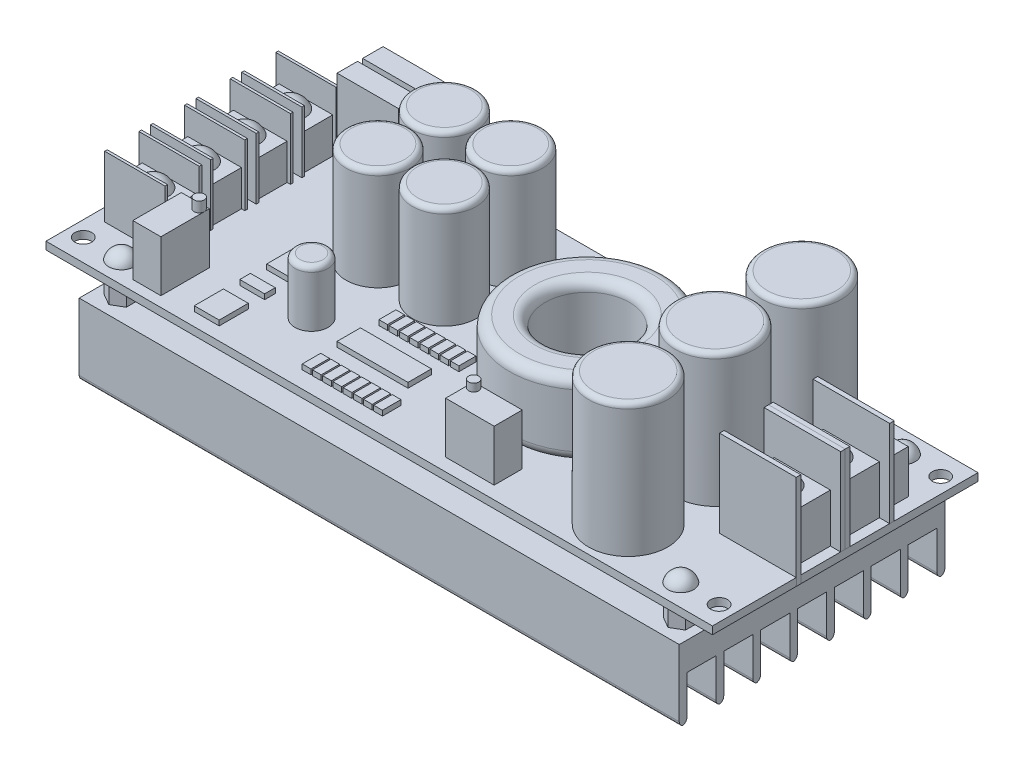
from build123d import *

# Parameters (mm, degrees)
CROQUIS1_W                  = 130.5
CROQUIS1_H                  = 52
CROQUIS1_R                  = 1.65
SALIENTE_EXTRUIR1_DEPTH     = 1.5
SALIENTE_EXTRUIR2_START     = -6.4
SALIENTE_EXTRUIR2_DEPTH     = 6.4
CROQUIS4_W                  = 117.5
CROQUIS4_H                  = 52
SALIENTE_EXTRUIR3_DEPTH     = 5.5
CROQUIS5_W                  = 117.5
CROQUIS5_H                  = 1.5
SALIENTE_EXTRUIR4_DEPTH     = 8.6
REDONDEO1_R                 = 1
CROQUIS7_W                  = 15
CROQUIS7_H                  = 0.9
SALIENTE_EXTRUIR5_DEPTH     = 18.5
SALIENTE_EXTRUIR5_2_DEPTH   = 18.5
CROQUIS8_W                  = 11
CROQUIS8_H                  = 7.8
SALIENTE_EXTRUIR6_DEPTH     = 11
CROQUIS10_W                 = 9.5
CROQUIS10_H                 = 5
SALIENTE_EXTRUIR7_DEPTH     = 10
CROQUIS11_R                 = 1
SALIENTE_EXTRUIR8_DEPTH     = 1.5
CROQUIS12_R                 = 7.75
SALIENTE_EXTRUIR9_DEPTH     = 26
SALIENTE_EXTRUIR9_2_DEPTH   = 26
SALIENTE_EXTRUIR9_3_DEPTH   = 26
CROQUIS15_W                 = 9.5
CROQUIS15_H                 = 5.5
SALIENTE_EXTRUIR10_DEPTH    = 10
CROQUIS16_R                 = 1
SALIENTE_EXTRUIR11_DEPTH    = 1.5
REDONDEO2_R                 = 1
REDONDEO3_R                 = 1
REDONDEO4_R                 = 1
CROQUIS17_W                 = 11.8
CROQUIS17_H                 = 0.5
SALIENTE_EXTRUIR12_DEPTH    = 12
SALIENTE_EXTRUIR12_2_DEPTH  = 12
SALIENTE_EXTRUIR12_3_DEPTH  = 12
SALIENTE_EXTRUIR12_4_DEPTH  = 12
SALIENTE_EXTRUIR12_5_DEPTH  = 12
SALIENTE_EXTRUIR12_6_DEPTH  = 12
SALIENTE_EXTRUIR12_7_DEPTH  = 12
SALIENTE_EXTRUIR12_8_DEPTH  = 12
CROQUIS18_W                 = 10.5
CROQUIS18_H                 = 6.2
SALIENTE_EXTRUIR13_DEPTH    = 7
SALIENTE_EXTRUIR13_2_DEPTH  = 7
SALIENTE_EXTRUIR13_3_DEPTH  = 7
SALIENTE_EXTRUIR13_4_DEPTH  = 7
CROQUIS21_W                 = 5.5
CROQUIS21_H                 = 9.5
SALIENTE_EXTRUIR14_DEPTH    = 10
CROQUIS22_R                 = 1
SALIENTE_EXTRUIR15_DEPTH    = 2
CROQUIS23_R                 = 6.25
SALIENTE_EXTRUIR16_DEPTH    = 20
SALIENTE_EXTRUIR16_2_DEPTH  = 20
SALIENTE_EXTRUIR16_3_DEPTH  = 20
SALIENTE_EXTRUIR16_4_DEPTH  = 20
REDONDEO5_R                 = 1
REDONDEO6_R                 = 1
REDONDEO7_R                 = 1
REDONDEO8_R                 = 1
CROQUIS24_R                 = 3.25
SALIENTE_EXTRUIR17_DEPTH    = 11
REDONDEO9_R                 = 1
CROQUIS25_W                 = 13.900747464
CROQUIS25_H                 = 4.587246663
SALIENTE_EXTRUIR18_DEPTH    = 1
CROQUIS25_W_2               = 4.865261613
CROQUIS25_H_2               = 5.69930646
SALIENTE_EXTRUIR18_2_DEPTH  = 1
CROQUIS25_H_3               = 2.08511212
SALIENTE_EXTRUIR18_3_DEPTH  = 1
CROQUIS25_H_4               = 4.865261613
SALIENTE_EXTRUIR18_4_DEPTH  = 1
CROQUIS26_W                 = 1.668089695
CROQUIS26_H                 = 3.336179392
SALIENTE_EXTRUIR19_DEPTH    = 1
CROQUIS26_W_2               = 1.709379691
CROQUIS26_H_2               = 3.614194341
SALIENTE_EXTRUIR19_2_DEPTH  = 1
SALIENTE_EXTRUIR19_3_DEPTH  = 1
SALIENTE_EXTRUIR19_4_DEPTH  = 1
SALIENTE_EXTRUIR19_5_DEPTH  = 1
SALIENTE_EXTRUIR19_6_DEPTH  = 1
SALIENTE_EXTRUIR19_7_DEPTH  = 1
SALIENTE_EXTRUIR19_8_DEPTH  = 1
SALIENTE_EXTRUIR19_9_DEPTH  = 1
SALIENTE_EXTRUIR19_10_DEPTH = 1
SALIENTE_EXTRUIR19_11_DEPTH = 1
SALIENTE_EXTRUIR19_12_DEPTH = 1
SALIENTE_EXTRUIR19_13_DEPTH = 1
SALIENTE_EXTRUIR19_14_DEPTH = 1
SALIENTE_EXTRUIR19_15_DEPTH = 1
SALIENTE_EXTRUIR19_16_DEPTH = 1
CROQUIS27_W                 = 12
CROQUIS27_H                 = 4
SALIENTE_EXTRUIR20_DEPTH    = 17
SALIENTE_EXTRUIR20_2_DEPTH  = 17
CROQUIS28_W                 = 4
CROQUIS28_H                 = 7
CORTAR_EXTRUIR2_DEPTH       = 17


with BuildPart() as part:
    # Croquis1 → Saliente-Extruir1 (new body)
    with BuildSketch(Plane(origin=(0, 0, 0), x_dir=(1, 0, 0), z_dir=(0, 1, 0))):
        Rectangle(CROQUIS1_W, CROQUIS1_H)
        with Locations(Location((62.25, 21.7, 0), (0, 0, 270))):
            Circle(CROQUIS1_R, mode=Mode.SUBTRACT)
        with Locations(Location((62.25, -21.7, 0), (0, 0, 90))):
            Circle(CROQUIS1_R, mode=Mode.SUBTRACT)
        with Locations(Location((-62.25, -21.7, 0), (0, 0, 270))):
            Circle(CROQUIS1_R, mode=Mode.SUBTRACT)
        with Locations(Location((-62.25, 21.7, 0), (0, 0, 90))):
            Circle(CROQUIS1_R, mode=Mode.SUBTRACT)
        with Locations(Location((54.75, 21.7, 0), (0, 0, 270))):
            Circle(CROQUIS1_R, mode=Mode.SUBTRACT)
        with Locations(Location((54.75, -21.7, 0), (0, 0, 90))):
            Circle(CROQUIS1_R, mode=Mode.SUBTRACT)
        with Locations(Location((-54.75, -21.7, 0), (0, 0, 270))):
            Circle(CROQUIS1_R, mode=Mode.SUBTRACT)
        with Locations(Location((-54.75, 21.7, 0), (0, 0, 90))):
            Circle(CROQUIS1_R, mode=Mode.SUBTRACT)
    extrude(amount=SALIENTE_EXTRUIR1_DEPTH)


with BuildPart() as body_2:
    # Croquis2 → Saliente-Extruir2 (new body)
    with BuildSketch(Plane(origin=(0, 1.5, 0), x_dir=(1, 0, 0), z_dir=(0, 1, 0)).offset(SALIENTE_EXTRUIR2_START)):
        Polygon((54.75, 19.2), (56.915063509, 20.45), (56.915063509, 22.95), (54.75, 24.2), (52.584936491, 22.95), (52.584936491, 20.45), align=None)
    extrude(amount=SALIENTE_EXTRUIR2_DEPTH)


with BuildPart() as body_3:
    # Croquis3 → Revolución1 (revolve)
    with BuildSketch(Plane(origin=(54.75, 0, 0), x_dir=(0, 0, -1), z_dir=(1, 0, 0))):
        with BuildLine():
            Line((21.7, 1.5), (24.2, 1.5))
            ThreePointArc((24.2, 1.5), (23.300781059, 2.938476324), (21.7, 3.5))
            Line((21.7, 3.5), (21.7, 1.5))
        make_face()
    revolve(axis=Axis((54.75, 1.5, -21.7), (0, 1, 0)))


with BuildPart() as body_2_1:
    add(body_2.part)

    # Combinar1: union body 3
    add(body_3.part)


with BuildPart() as body_3_2:
    # Simetría3: mirrored copy
    add(body_2_1.part.mirror(Plane.XY))


with BuildPart() as body_4:
    # Simetría4: mirrored copy
    add(body_2_1.part.mirror(Plane(origin=(0, 0, 0), x_dir=(0, 0, 1), z_dir=(1, 0, 0))))


with BuildPart() as body_5:
    # Simetr_a4 2: mirrored copy
    add(body_3_2.part.mirror(Plane(origin=(0, 0, 0), x_dir=(0, 0, 1), z_dir=(1, 0, 0))))


with BuildPart() as body_2_2:
    add(body_2_1.part)

    add(body_3_2.part)  # Saliente-Extruir3 merges body 3 2

    add(body_4.part)  # Saliente-Extruir3 merges body 4

    add(body_5.part)  # Saliente-Extruir3 merges body 5
    # Croquis4 → Saliente-Extruir3 (add)
    with BuildSketch(Plane.XZ.offset(4.9)):
        Rectangle(CROQUIS4_W, CROQUIS4_H)
    extrude(amount=SALIENTE_EXTRUIR3_DEPTH)

    # Croquis5 → Saliente-Extruir4 (add)
    with BuildSketch(Plane.XZ.offset(10.4)):
        with Locations((0, 25.25)):
            Rectangle(CROQUIS5_W, CROQUIS5_H)
        with Locations((0, 18.035714286)):
            Rectangle(CROQUIS5_W, CROQUIS5_H)
        with Locations((0, 10.821428571)):
            Rectangle(CROQUIS5_W, CROQUIS5_H)
        with Locations((0, 3.607142857)):
            Rectangle(CROQUIS5_W, CROQUIS5_H)
        with Locations((0, -3.607142857)):
            Rectangle(CROQUIS5_W, CROQUIS5_H)
        with Locations((0, -10.821428571)):
            Rectangle(CROQUIS5_W, CROQUIS5_H)
        with Locations((0, -18.035714286)):
            Rectangle(CROQUIS5_W, CROQUIS5_H)
        with Locations((0, -25.25)):
            Rectangle(CROQUIS5_W, CROQUIS5_H)
    extrude(amount=SALIENTE_EXTRUIR4_DEPTH)

    # Redondeo1
    # the kernel refuses this fillet: 1 mm, written as the material it takes off along each edge
    with BuildSketch(Plane(origin=(-61.25, -19, -26), x_dir=(0, 1, 0), z_dir=(1, 0, 0)), Plane(origin=(-61.25, -19, -18.785714286), x_dir=(0, 1, 0), z_dir=(1, 0, 0)), Plane(origin=(-61.25, -19, -11.571428571), x_dir=(0, 1, 0), z_dir=(1, 0, 0)), Plane(origin=(-61.25, -19, -4.357142857), x_dir=(0, 1, 0), z_dir=(1, 0, 0)), Plane(origin=(-61.25, -19, 2.857142857), x_dir=(0, 1, 0), z_dir=(1, 0, 0)), Plane(origin=(-61.25, -19, 10.071428571), x_dir=(0, 1, 0), z_dir=(1, 0, 0)), Plane(origin=(-61.25, -19, 17.285714286), x_dir=(0, 1, 0), z_dir=(1, 0, 0))) as redondeo1_piece_1:
        with BuildLine():
            CenterArc((REDONDEO1_R, REDONDEO1_R), REDONDEO1_R, 180, 90)
            Line((0, REDONDEO1_R), (0, 0))
            Line((0, 0), (REDONDEO1_R, 0))
        make_face()
    extrude(amount=122.5, mode=Mode.SUBTRACT)
    with BuildSketch(Plane(origin=(61.25, -19, -24.5), x_dir=(0, 0, -1), z_dir=(-1, 0, 0)), Plane(origin=(61.25, -19, -17.285714286), x_dir=(0, 0, -1), z_dir=(-1, 0, 0)), Plane(origin=(61.25, -19, -10.071428571), x_dir=(0, 0, -1), z_dir=(-1, 0, 0)), Plane(origin=(61.25, -19, -2.857142857), x_dir=(0, 0, -1), z_dir=(-1, 0, 0)), Plane(origin=(61.25, -19, 4.357142857), x_dir=(0, 0, -1), z_dir=(-1, 0, 0)), Plane(origin=(61.25, -19, 11.571428571), x_dir=(0, 0, -1), z_dir=(-1, 0, 0)), Plane(origin=(61.25, -19, 18.785714286), x_dir=(0, 0, -1), z_dir=(-1, 0, 0)), Plane(origin=(61.25, -19, 24.5), x_dir=(0, 1, 0), z_dir=(-1, 0, 0)), Plane(origin=(-61.25, -19, 26), x_dir=(0, 1, 0), z_dir=(1, 0, 0))) as redondeo1_piece_2:
        with BuildLine():
            CenterArc((REDONDEO1_R, -REDONDEO1_R), REDONDEO1_R, 90, 90)
            Line((0, -REDONDEO1_R), (0, 0))
            Line((0, 0), (REDONDEO1_R, 0))
        make_face()
    extrude(amount=122.5, mode=Mode.SUBTRACT)


with BuildPart() as body_3_3:
    # Croquis7 → Saliente-Extruir5 (new body)
    with BuildSketch(Plane(origin=(0, 0, 0), x_dir=(1, 0, 0), z_dir=(0, 1, 0))):
        with Locations((57.75, -0.45)):
            Rectangle(CROQUIS7_W, CROQUIS7_H)
    extrude(amount=SALIENTE_EXTRUIR5_DEPTH)


with BuildPart() as body_4_2:
    # Croquis7 → Saliente-Extruir5 2 (new body)
    with BuildSketch(Plane(origin=(0, 0, 0), x_dir=(1, 0, 0), z_dir=(0, 1, 0))):
        with Locations((57.75, -9.15)):
            Rectangle(CROQUIS7_W, CROQUIS7_H)
    extrude(amount=SALIENTE_EXTRUIR5_2_DEPTH)


with BuildPart() as body_5_2:
    # Croquis8 → Saliente-Extruir6 (new body)
    with BuildSketch(Plane(origin=(0, 0, 0), x_dir=(1, 0, 0), z_dir=(0, 1, 0))):
        with Locations((57.75, -4.8)):
            Rectangle(CROQUIS8_W, CROQUIS8_H)
    extrude(amount=SALIENTE_EXTRUIR6_DEPTH)

    # Combinar2: union body 3 3, body 4 2
    add(body_3_3.part)
    add(body_4_2.part)


with BuildPart() as body_4_3:
    # Croquis9 → Revolución2 (revolve)
    with BuildSketch(Plane(origin=(57.75, 0, 0), x_dir=(0, 0, -1), z_dir=(1, 0, 0))):
        with BuildLine():
            Line((-4.8, 11), (-4.8, 13))
            ThreePointArc((-4.8, 13), (-2.997224362, 12.454163457), (-1.8, 11))
            Line((-1.8, 11), (-4.8, 11))
        make_face()
    revolve(axis=Axis((57.75, 11, 4.8), (0, 1, 0)))


with BuildPart() as body_5_3:
    # Simetría5: mirrored copy
    add(body_5_2.part.mirror(Plane.XY))


with BuildPart() as body_6:
    # Simetr_a5 2: mirrored copy
    add(body_4_3.part.mirror(Plane.XY))


with BuildPart() as body_7:
    # Croquis10 → Saliente-Extruir7 (new body)
    with BuildSketch(Plane(origin=(0, 0, 0), x_dir=(1, 0, 0), z_dir=(0, 1, 0))):
        with Locations((57.75, 12.6)):
            Rectangle(CROQUIS10_W, CROQUIS10_H)
    extrude(amount=SALIENTE_EXTRUIR7_DEPTH)


with BuildPart() as body_8:
    # Croquis11 → Saliente-Extruir8 (new body)
    with BuildSketch(Plane(origin=(0, 10, 0), x_dir=(1, 0, 0), z_dir=(0, 1, 0))):
        with Locations(Location((61.5, 11.1, 0), (0, 0, 270))):
            Circle(CROQUIS11_R)
    extrude(amount=SALIENTE_EXTRUIR8_DEPTH)


with BuildPart() as body_9:
    # Croquis12 → Saliente-Extruir9 (new body)
    with BuildSketch(Plane(origin=(0, 1.5, 0), x_dir=(1, 0, 0), z_dir=(0, 1, 0))):
        with Locations(Location((39.75, 17, 0), (0, 0, 90))):
            Circle(CROQUIS12_R)
    extrude(amount=SALIENTE_EXTRUIR9_DEPTH)

    # Redondeo4
    redondeo4_edges = [body_9.edges().sort_by_distance(p)[0] for p in [
        (39.75, 27.5, -9.25),
    ]]
    fillet(redondeo4_edges, radius=REDONDEO4_R)


with BuildPart() as body_10:
    # Croquis12 → Saliente-Extruir9 2 (new body)
    with BuildSketch(Plane(origin=(0, 1.5, 0), x_dir=(1, 0, 0), z_dir=(0, 1, 0))):
        with Locations(Location((39.75, 0, 0), (0, 0, 90))):
            Circle(CROQUIS12_R)
    extrude(amount=SALIENTE_EXTRUIR9_2_DEPTH)

    # Redondeo3
    redondeo3_edges = [body_10.edges().sort_by_distance(p)[0] for p in [
        (39.75, 27.5, 7.75),
    ]]
    fillet(redondeo3_edges, radius=REDONDEO3_R)


with BuildPart() as body_11:
    # Croquis12 → Saliente-Extruir9 3 (new body)
    with BuildSketch(Plane(origin=(0, 1.5, 0), x_dir=(1, 0, 0), z_dir=(0, 1, 0))):
        with Locations(Location((39.75, -17, 0), (0, 0, 90))):
            Circle(CROQUIS12_R)
    extrude(amount=SALIENTE_EXTRUIR9_3_DEPTH)

    # Redondeo2
    redondeo2_edges = [body_11.edges().sort_by_distance(p)[0] for p in [
        (39.75, 27.5, 24.75),
    ]]
    fillet(redondeo2_edges, radius=REDONDEO2_R)


with BuildPart() as body_12:
    # Croquis14 → Revolución3 (revolve)
    with BuildSketch(Plane.XY, mode=Mode.PRIVATE) as revoluci_n3_sk:
        with BuildLine():
            Line((28, 1.5), (25, 1.5))
            ThreePointArc((25, 1.5), (23.585786438, 2.085786438), (23, 3.5))
            Line((23, 3.5), (23, 14))
            ThreePointArc((23, 14), (23.585786438, 15.414213562), (25, 16))
            Line((25, 16), (28, 16))
            ThreePointArc((28, 16), (29.414213562, 15.414213562), (30, 14))
            Line((30, 14), (30, 3.5))
            ThreePointArc((30, 3.5), (29.414213562, 2.085786438), (28, 1.5))
        make_face()
    revolve(revoluci_n3_sk.sketch.rotate(Axis((14.75, 1.5, 0), (0, 1, 0)), 90), axis=Axis((14.75, 1.5, 0), (0, 1, 0)))


with BuildPart() as body_13:
    # Croquis15 → Saliente-Extruir10 (new body)
    with BuildSketch(Plane(origin=(0, 1.5, 0), x_dir=(1, 0, 0), z_dir=(0, 1, 0))):
        with Locations((15.25, -20.75)):
            Rectangle(CROQUIS15_W, CROQUIS15_H)
    extrude(amount=SALIENTE_EXTRUIR10_DEPTH)


with BuildPart() as body_14:
    # Croquis16 → Saliente-Extruir11 (new body)
    with BuildSketch(Plane(origin=(0, 11.5, 0), x_dir=(1, 0, 0), z_dir=(0, 1, 0))):
        with Locations(Location((11.5, -19, 0), (0, 0, 270))):
            Circle(CROQUIS16_R)
    extrude(amount=SALIENTE_EXTRUIR11_DEPTH)


with BuildPart() as body_15:
    # Croquis17 → Saliente-Extruir12 (new body)
    with BuildSketch(Plane(origin=(0, 1.5, 0), x_dir=(1, 0, 0), z_dir=(0, 1, 0))):
        with Locations((-56.85, 16.75)):
            Rectangle(CROQUIS17_W, CROQUIS17_H)
    extrude(amount=SALIENTE_EXTRUIR12_DEPTH)


with BuildPart() as body_16:
    # Croquis17 → Saliente-Extruir12 2 (new body)
    with BuildSketch(Plane(origin=(0, 1.5, 0), x_dir=(1, 0, 0), z_dir=(0, 1, 0))):
        with Locations((-56.85, 10.05)):
            Rectangle(CROQUIS17_W, CROQUIS17_H)
    extrude(amount=SALIENTE_EXTRUIR12_2_DEPTH)


with BuildPart() as body_17:
    # Croquis17 → Saliente-Extruir12 3 (new body)
    with BuildSketch(Plane(origin=(0, 1.5, 0), x_dir=(1, 0, 0), z_dir=(0, 1, 0))):
        with Locations((-56.85, 1.116666667)):
            Rectangle(CROQUIS17_W, CROQUIS17_H)
    extrude(amount=SALIENTE_EXTRUIR12_3_DEPTH)


with BuildPart() as body_18:
    # Croquis17 → Saliente-Extruir12 4 (new body)
    with BuildSketch(Plane(origin=(0, 1.5, 0), x_dir=(1, 0, 0), z_dir=(0, 1, 0))):
        with Locations((-56.85, 7.816666667)):
            Rectangle(CROQUIS17_W, CROQUIS17_H)
    extrude(amount=SALIENTE_EXTRUIR12_4_DEPTH)


with BuildPart() as body_19:
    # Croquis17 → Saliente-Extruir12 5 (new body)
    with BuildSketch(Plane(origin=(0, 1.5, 0), x_dir=(1, 0, 0), z_dir=(0, 1, 0))):
        with Locations((-56.85, -7.816666667)):
            Rectangle(CROQUIS17_W, CROQUIS17_H)
    extrude(amount=SALIENTE_EXTRUIR12_5_DEPTH)


with BuildPart() as body_20:
    # Croquis17 → Saliente-Extruir12 6 (new body)
    with BuildSketch(Plane(origin=(0, 1.5, 0), x_dir=(1, 0, 0), z_dir=(0, 1, 0))):
        with Locations((-56.85, -1.116666667)):
            Rectangle(CROQUIS17_W, CROQUIS17_H)
    extrude(amount=SALIENTE_EXTRUIR12_6_DEPTH)


with BuildPart() as body_21:
    # Croquis17 → Saliente-Extruir12 7 (new body)
    with BuildSketch(Plane(origin=(0, 1.5, 0), x_dir=(1, 0, 0), z_dir=(0, 1, 0))):
        with Locations((-56.85, -16.75)):
            Rectangle(CROQUIS17_W, CROQUIS17_H)
    extrude(amount=SALIENTE_EXTRUIR12_7_DEPTH)


with BuildPart() as body_22:
    # Croquis17 → Saliente-Extruir12 8 (new body)
    with BuildSketch(Plane(origin=(0, 1.5, 0), x_dir=(1, 0, 0), z_dir=(0, 1, 0))):
        with Locations((-56.85, -10.05)):
            Rectangle(CROQUIS17_W, CROQUIS17_H)
    extrude(amount=SALIENTE_EXTRUIR12_8_DEPTH)


with BuildPart() as body_23:
    # Croquis18 → Saliente-Extruir13 (new body)
    with BuildSketch(Plane(origin=(0, 1.5, 0), x_dir=(1, 0, 0), z_dir=(0, 1, 0))):
        with Locations((-56.85, 13.4)):
            Rectangle(CROQUIS18_W, CROQUIS18_H)
    extrude(amount=SALIENTE_EXTRUIR13_DEPTH)

    # Combinar6: union body 16, body 15
    add(body_16.part)
    add(body_15.part)


with BuildPart() as body_24:
    # Croquis18 → Saliente-Extruir13 2 (new body)
    with BuildSketch(Plane(origin=(0, 1.5, 0), x_dir=(1, 0, 0), z_dir=(0, 1, 0))):
        with Locations((-56.85, 4.466666667)):
            Rectangle(CROQUIS18_W, CROQUIS18_H)
    extrude(amount=SALIENTE_EXTRUIR13_2_DEPTH)

    # Combinar5: union body 17, body 18
    add(body_17.part)
    add(body_18.part)


with BuildPart() as body_25:
    # Croquis18 → Saliente-Extruir13 3 (new body)
    with BuildSketch(Plane(origin=(0, 1.5, 0), x_dir=(1, 0, 0), z_dir=(0, 1, 0))):
        with Locations((-56.85, -4.466666667)):
            Rectangle(CROQUIS18_W, CROQUIS18_H)
    extrude(amount=SALIENTE_EXTRUIR13_3_DEPTH)

    # Combinar4: union body 19, body 20
    add(body_19.part)
    add(body_20.part)


with BuildPart() as body_26:
    # Croquis18 → Saliente-Extruir13 4 (new body)
    with BuildSketch(Plane(origin=(0, 1.5, 0), x_dir=(1, 0, 0), z_dir=(0, 1, 0))):
        with Locations((-56.85, -13.4)):
            Rectangle(CROQUIS18_W, CROQUIS18_H)
    extrude(amount=SALIENTE_EXTRUIR13_4_DEPTH)

    # Combinar3: union body 21, body 22
    add(body_21.part)
    add(body_22.part)


with BuildPart() as body_19_2:
    # Croquis19 → Revolución4 (revolve)
    with BuildSketch(Plane(origin=(-56.85, 0, 0), x_dir=(0, 0, -1), z_dir=(1, 0, 0))):
        with BuildLine():
            Line((13.4, 8.5), (13.4, 10.5))
            ThreePointArc((13.4, 10.5), (11.597224362, 9.954163457), (10.4, 8.5))
            Line((10.4, 8.5), (13.4, 8.5))
        make_face()
    revolve(axis=Axis((-56.85, 8.5, -13.4), (0, 1, 0)))


with BuildPart() as body_20_2:
    # Croquis20 → Revolución5 (revolve)
    with BuildSketch(Plane(origin=(-56.85, 0, 0), x_dir=(0, 0, -1), z_dir=(1, 0, 0))):
        with BuildLine():
            Line((4.466666667, 8.5), (4.466666667, 10.5))
            ThreePointArc((4.466666667, 10.5), (2.663891029, 9.954163457), (1.466666667, 8.5))
            Line((1.466666667, 8.5), (4.466666667, 8.5))
        make_face()
    revolve(axis=Axis((-56.85, 8.5, -4.466666667), (0, 1, 0)))


with BuildPart() as body_21_2:
    # Simetría6: mirrored copy
    add(body_19_2.part.mirror(Plane.XY))


with BuildPart() as body_22_2:
    # Simetr_a6 2: mirrored copy
    add(body_20_2.part.mirror(Plane.XY))


with BuildPart() as body_23_2:
    # Croquis21 → Saliente-Extruir14 (new body)
    with BuildSketch(Plane(origin=(0, 1.5, 0), x_dir=(1, 0, 0), z_dir=(0, 1, 0))):
        with Locations((-47.5, -19.25)):
            Rectangle(CROQUIS21_W, CROQUIS21_H)
    extrude(amount=SALIENTE_EXTRUIR14_DEPTH)


with BuildPart() as body_24_2:
    # Croquis22 → Saliente-Extruir15 (new body)
    with BuildSketch(Plane(origin=(0, 11.5, 0), x_dir=(1, 0, 0), z_dir=(0, 1, 0))):
        with Locations(Location((-45.75, -15.5, 0), (0, 0, 270))):
            Circle(CROQUIS22_R)
    extrude(amount=SALIENTE_EXTRUIR15_DEPTH)


with BuildPart() as body_25_2:
    # Croquis23 → Saliente-Extruir16 (new body)
    with BuildSketch(Plane(origin=(0, 1.5, 0), x_dir=(1, 0, 0), z_dir=(0, 1, 0))):
        with Locations(Location((-29.25, 16, 0), (0, 0, 270))):
            Circle(CROQUIS23_R)
    extrude(amount=SALIENTE_EXTRUIR16_DEPTH)

    # Redondeo8
    redondeo8_edges = [body_25_2.edges().sort_by_distance(p)[0] for p in [
        (-29.25, 21.5, -22.25),
    ]]
    fillet(redondeo8_edges, radius=REDONDEO8_R)


with BuildPart() as body_26_2:
    # Croquis23 → Saliente-Extruir16 2 (new body)
    with BuildSketch(Plane(origin=(0, 1.5, 0), x_dir=(1, 0, 0), z_dir=(0, 1, 0))):
        with Locations(Location((-16.25, 16, 0), (0, 0, 270))):
            Circle(CROQUIS23_R)
    extrude(amount=SALIENTE_EXTRUIR16_2_DEPTH)

    # Redondeo5
    redondeo5_edges = [body_26_2.edges().sort_by_distance(p)[0] for p in [
        (-16.25, 21.5, -22.25),
    ]]
    fillet(redondeo5_edges, radius=REDONDEO5_R)


with BuildPart() as body_27:
    # Croquis23 → Saliente-Extruir16 3 (new body)
    with BuildSketch(Plane(origin=(0, 1.5, 0), x_dir=(1, 0, 0), z_dir=(0, 1, 0))):
        with Locations(Location((-16.25, 3, 0), (0, 0, 270))):
            Circle(CROQUIS23_R)
    extrude(amount=SALIENTE_EXTRUIR16_3_DEPTH)

    # Redondeo6
    redondeo6_edges = [body_27.edges().sort_by_distance(p)[0] for p in [
        (-16.25, 21.5, -9.25),
    ]]
    fillet(redondeo6_edges, radius=REDONDEO6_R)


with BuildPart() as body_28:
    # Croquis23 → Saliente-Extruir16 4 (new body)
    with BuildSketch(Plane(origin=(0, 1.5, 0), x_dir=(1, 0, 0), z_dir=(0, 1, 0))):
        with Locations(Location((-29.25, 3, 0), (0, 0, 270))):
            Circle(CROQUIS23_R)
    extrude(amount=SALIENTE_EXTRUIR16_4_DEPTH)

    # Redondeo7
    redondeo7_edges = [body_28.edges().sort_by_distance(p)[0] for p in [
        (-29.25, 21.5, -9.25),
    ]]
    fillet(redondeo7_edges, radius=REDONDEO7_R)


with BuildPart() as body_29:
    # Croquis24 → Saliente-Extruir17 (new body)
    with BuildSketch(Plane(origin=(0, 1.5, 0), x_dir=(1, 0, 0), z_dir=(0, 1, 0))):
        with Locations(Location((-26.25, -13, 0), (0, 0, 270))):
            Circle(CROQUIS24_R)
    extrude(amount=SALIENTE_EXTRUIR17_DEPTH)

    # Redondeo9
    redondeo9_edges = [body_29.edges().sort_by_distance(p)[0] for p in [
        (-26.25, 12.5, 9.75),
    ]]
    fillet(redondeo9_edges, radius=REDONDEO9_R)


with BuildPart() as body_30:
    # Croquis25 → Saliente-Extruir18 (new body)
    with BuildSketch(Plane(origin=(0, 1.5, 0), x_dir=(1, 0, 0), z_dir=(0, 1, 0))):
        with Locations((-11.815635345, -13.205710092)):
            Rectangle(CROQUIS25_W, CROQUIS25_H)
    extrude(amount=SALIENTE_EXTRUIR18_DEPTH)


with BuildPart() as body_31:
    # Croquis25 → Saliente-Extruir18 2 (new body)
    with BuildSketch(Plane(origin=(0, 1.5, 0), x_dir=(1, 0, 0), z_dir=(0, 1, 0))):
        with Locations((-36.350454621, -20.573106248)):
            Rectangle(CROQUIS25_W_2, CROQUIS25_H_2)
    extrude(amount=SALIENTE_EXTRUIR18_2_DEPTH)


with BuildPart() as body_32:
    # Croquis25 → Saliente-Extruir18 3 (new body)
    with BuildSketch(Plane(origin=(0, 1.5, 0), x_dir=(1, 0, 0), z_dir=(0, 1, 0))):
        with Locations((-36.350454621, -13.483725041)):
            Rectangle(CROQUIS25_W_2, CROQUIS25_H_3)
    extrude(amount=SALIENTE_EXTRUIR18_3_DEPTH)


with BuildPart() as body_33:
    # Croquis25 → Saliente-Extruir18 4 (new body)
    with BuildSketch(Plane(origin=(0, 1.5, 0), x_dir=(1, 0, 0), z_dir=(0, 1, 0))):
        with Locations((-36.350454621, -6.811366257)):
            Rectangle(CROQUIS25_W_2, CROQUIS25_H_4)
    extrude(amount=SALIENTE_EXTRUIR18_4_DEPTH)


with BuildPart() as body_34:
    # Croquis26 → Saliente-Extruir19 (new body)
    with BuildSketch(Plane(origin=(0, 1.5, 0), x_dir=(1, 0, 0), z_dir=(0, 1, 0))):
        with Locations((-15.514941806, -6.046825147)):
            Rectangle(CROQUIS26_W, CROQUIS26_H)
    extrude(amount=SALIENTE_EXTRUIR19_DEPTH)


with BuildPart() as body_35:
    # Croquis26 → Saliente-Extruir19 2 (new body)
    with BuildSketch(Plane(origin=(0, 1.5, 0), x_dir=(1, 0, 0), z_dir=(0, 1, 0))):
        with Locations((-17.494296807, -20.920624935)):
            Rectangle(CROQUIS26_W_2, CROQUIS26_H_2)
    extrude(amount=SALIENTE_EXTRUIR19_2_DEPTH)


with BuildPart() as body_36:
    # Croquis26 → Saliente-Extruir19 3 (new body)
    with BuildSketch(Plane(origin=(0, 1.5, 0), x_dir=(1, 0, 0), z_dir=(0, 1, 0))):
        with Locations((-17.514941806, -6.046825147)):
            Rectangle(CROQUIS26_W, CROQUIS26_H)
    extrude(amount=SALIENTE_EXTRUIR19_3_DEPTH)


with BuildPart() as body_37:
    # Croquis26 → Saliente-Extruir19 4 (new body)
    with BuildSketch(Plane(origin=(0, 1.5, 0), x_dir=(1, 0, 0), z_dir=(0, 1, 0))):
        with Locations((-15.494296807, -20.920624935)):
            Rectangle(CROQUIS26_W_2, CROQUIS26_H_2)
    extrude(amount=SALIENTE_EXTRUIR19_4_DEPTH)


with BuildPart() as body_38:
    # Croquis26 → Saliente-Extruir19 5 (new body)
    with BuildSketch(Plane(origin=(0, 1.5, 0), x_dir=(1, 0, 0), z_dir=(0, 1, 0))):
        with Locations((-13.514941806, -6.046825147)):
            Rectangle(CROQUIS26_W, CROQUIS26_H)
    extrude(amount=SALIENTE_EXTRUIR19_5_DEPTH)


with BuildPart() as body_39:
    # Croquis26 → Saliente-Extruir19 6 (new body)
    with BuildSketch(Plane(origin=(0, 1.5, 0), x_dir=(1, 0, 0), z_dir=(0, 1, 0))):
        with Locations((-13.494296807, -20.920624935)):
            Rectangle(CROQUIS26_W_2, CROQUIS26_H_2)
    extrude(amount=SALIENTE_EXTRUIR19_6_DEPTH)


with BuildPart() as body_40:
    # Croquis26 → Saliente-Extruir19 7 (new body)
    with BuildSketch(Plane(origin=(0, 1.5, 0), x_dir=(1, 0, 0), z_dir=(0, 1, 0))):
        with Locations((-11.514941806, -6.046825147)):
            Rectangle(CROQUIS26_W, CROQUIS26_H)
    extrude(amount=SALIENTE_EXTRUIR19_7_DEPTH)


with BuildPart() as body_41:
    # Croquis26 → Saliente-Extruir19 8 (new body)
    with BuildSketch(Plane(origin=(0, 1.5, 0), x_dir=(1, 0, 0), z_dir=(0, 1, 0))):
        with Locations((-11.494296807, -20.920624935)):
            Rectangle(CROQUIS26_W_2, CROQUIS26_H_2)
    extrude(amount=SALIENTE_EXTRUIR19_8_DEPTH)


with BuildPart() as body_42:
    # Croquis26 → Saliente-Extruir19 9 (new body)
    with BuildSketch(Plane(origin=(0, 1.5, 0), x_dir=(1, 0, 0), z_dir=(0, 1, 0))):
        with Locations((-9.514941806, -6.046825147)):
            Rectangle(CROQUIS26_W, CROQUIS26_H)
    extrude(amount=SALIENTE_EXTRUIR19_9_DEPTH)


with BuildPart() as body_43:
    # Croquis26 → Saliente-Extruir19 10 (new body)
    with BuildSketch(Plane(origin=(0, 1.5, 0), x_dir=(1, 0, 0), z_dir=(0, 1, 0))):
        with Locations((-9.494296807, -20.920624935)):
            Rectangle(CROQUIS26_W_2, CROQUIS26_H_2)
    extrude(amount=SALIENTE_EXTRUIR19_10_DEPTH)


with BuildPart() as body_44:
    # Croquis26 → Saliente-Extruir19 11 (new body)
    with BuildSketch(Plane(origin=(0, 1.5, 0), x_dir=(1, 0, 0), z_dir=(0, 1, 0))):
        with Locations((-7.514941806, -6.046825147)):
            Rectangle(CROQUIS26_W, CROQUIS26_H)
    extrude(amount=SALIENTE_EXTRUIR19_11_DEPTH)


with BuildPart() as body_45:
    # Croquis26 → Saliente-Extruir19 12 (new body)
    with BuildSketch(Plane(origin=(0, 1.5, 0), x_dir=(1, 0, 0), z_dir=(0, 1, 0))):
        with Locations((-7.494296808, -20.920624935)):
            Rectangle(CROQUIS26_W_2, CROQUIS26_H_2)
    extrude(amount=SALIENTE_EXTRUIR19_12_DEPTH)


with BuildPart() as body_46:
    # Croquis26 → Saliente-Extruir19 13 (new body)
    with BuildSketch(Plane(origin=(0, 1.5, 0), x_dir=(1, 0, 0), z_dir=(0, 1, 0))):
        with Locations((-5.514941806, -6.046825147)):
            Rectangle(CROQUIS26_W, CROQUIS26_H)
    extrude(amount=SALIENTE_EXTRUIR19_13_DEPTH)


with BuildPart() as body_47:
    # Croquis26 → Saliente-Extruir19 14 (new body)
    with BuildSketch(Plane(origin=(0, 1.5, 0), x_dir=(1, 0, 0), z_dir=(0, 1, 0))):
        with Locations((-5.494296808, -20.920624935)):
            Rectangle(CROQUIS26_W_2, CROQUIS26_H_2)
    extrude(amount=SALIENTE_EXTRUIR19_14_DEPTH)


with BuildPart() as body_48:
    # Croquis26 → Saliente-Extruir19 15 (new body)
    with BuildSketch(Plane(origin=(0, 1.5, 0), x_dir=(1, 0, 0), z_dir=(0, 1, 0))):
        with Locations((-3.514941806, -6.046825147)):
            Rectangle(CROQUIS26_W, CROQUIS26_H)
    extrude(amount=SALIENTE_EXTRUIR19_15_DEPTH)


with BuildPart() as body_49:
    # Croquis26 → Saliente-Extruir19 16 (new body)
    with BuildSketch(Plane(origin=(0, 1.5, 0), x_dir=(1, 0, 0), z_dir=(0, 1, 0))):
        with Locations((-3.494296808, -20.920624935)):
            Rectangle(CROQUIS26_W_2, CROQUIS26_H_2)
    extrude(amount=SALIENTE_EXTRUIR19_16_DEPTH)


with BuildPart() as body_50:
    # Croquis27 → Saliente-Extruir20 (new body)
    with BuildSketch(Plane(origin=(0, 1.5, 0), x_dir=(1, 0, 0), z_dir=(0, 1, 0))):
        with Locations((-42.25, 21)):
            Rectangle(CROQUIS27_W, CROQUIS27_H)
    extrude(amount=SALIENTE_EXTRUIR20_DEPTH)


with BuildPart() as body_51:
    # Croquis27 → Saliente-Extruir20 2 (new body)
    with BuildSketch(Plane(origin=(0, 1.5, 0), x_dir=(1, 0, 0), z_dir=(0, 1, 0))):
        with Locations((-42.25, 16)):
            Rectangle(CROQUIS27_W, CROQUIS27_H)
    extrude(amount=SALIENTE_EXTRUIR20_2_DEPTH)


with BuildPart() as cortar_extruir2_tool:
    # Croquis28 → Cortar-Extruir2 (new body)
    with BuildSketch(Plane.XY.offset(-14)):
        with Locations((-42.25, 5)):
            Rectangle(CROQUIS28_W, CROQUIS28_H)
    extrude(amount=-CORTAR_EXTRUIR2_DEPTH)


with BuildPart() as body_50_1:
    add(body_50.part)

    # Cortar-Extruir2: cut by cortar_extruir2_tool
    add(cortar_extruir2_tool.part, mode=Mode.SUBTRACT)


with BuildPart() as body_51_1:
    add(body_51.part)

    # Cortar-Extruir2: cut by cortar_extruir2_tool
    add(cortar_extruir2_tool.part, mode=Mode.SUBTRACT)


solid = Compound([part.part, body_2_2.part, body_5_2.part, body_4_3.part, body_5_3.part, body_6.part, body_7.part, body_8.part, body_9.part, body_10.part, body_11.part, body_12.part, body_13.part, body_14.part, body_23.part, body_24.part, body_25.part, body_26.part, body_19_2.part, body_20_2.part, body_21_2.part, body_22_2.part, body_23_2.part, body_24_2.part, body_25_2.part, body_26_2.part, body_27.part, body_28.part, body_29.part, body_30.part, body_31.part, body_32.part, body_33.part, body_34.part, body_35.part, body_36.part, body_37.part, body_38.part, body_39.part, body_40.part, body_41.part, body_42.part, body_43.part, body_44.part, body_45.part, body_46.part, body_47.part, body_48.part, body_49.part, body_50_1.part, body_51_1.part])
